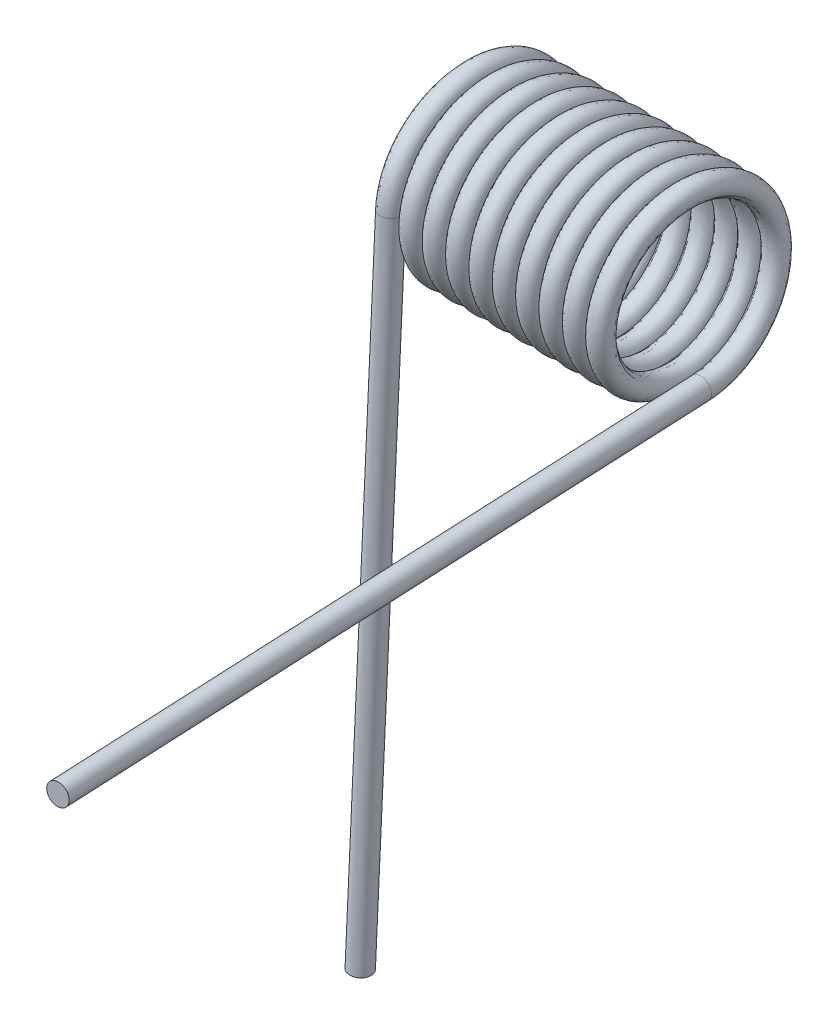
from build123d import *

# Parameters (mm, degrees)
SWEEP1_PITCH       = 0.3302
SWEEP1_HEIGHT      = 3.21945
SWEEP1_RADIUS      = 1.1557
SWEEP1_START_ANGLE = 90
SKETCH3_R          = 0.1524
SKETCH4_R          = 0.1524
EXTRUDE1_DEPTH     = 9.525
SKETCH5_R          = 0.1524
EXTRUDE2_DEPTH     = 9.525


with BuildPart() as part:
    # Sweep1: sweep along a helix
    with BuildLine() as sweep1_path:
        add(Helix(SWEEP1_PITCH, SWEEP1_HEIGHT, SWEEP1_RADIUS, center=(0, 0, 0), direction=(-1, 0, 0), lefthand=True, mode=Mode.PRIVATE).rotate(Axis((0, 0, 0), (-1, 0, 0)), SWEEP1_START_ANGLE))
    # Sketch3 → Sweep1 (sweep)
    with BuildSketch(Plane(origin=(0, -1.1557, 0), x_dir=(0.998697994421586, -0.023236129092747727, -0.045413634990902306), z_dir=(-0.04542589977017189, 1.1528538540472866e-14, -0.9989677110047505))):
        Circle(SKETCH3_R)
    sweep(path=sweep1_path.line, is_frenet=True)

    # Sketch4 → Extrude1 (add)
    with BuildSketch(Plane(origin=(0, 0, 0), x_dir=(-0.998697994421586, 0.02323612909274776, 0.0454136349909023), z_dir=(0.045425899770171876, -1.1527888019169374e-14, 0.9989677110047503))):
        with Locations(Location((-0.026853994, 1.155387966, 0), (0, 0, 1.33145196))):
            Circle(SKETCH4_R)
    extrude(amount=EXTRUDE1_DEPTH)

    # Sketch5 → Extrude2 (add)
    with BuildSketch(Plane(origin=(-0.006643375, -0.146095444, 0), x_dir=(0.9437256783423545, -0.042913887608790245, -0.3279332893860624), z_dir=(-0.04542589977017188, -0.9989677110047505, -1.4928683289561206e-13))):
        with Locations(Location((-3.417270138, 0.037115836, 0), (0, 0, 199.143382482))):
            Circle(SKETCH5_R)
    extrude(amount=EXTRUDE2_DEPTH)


solid = part.part
